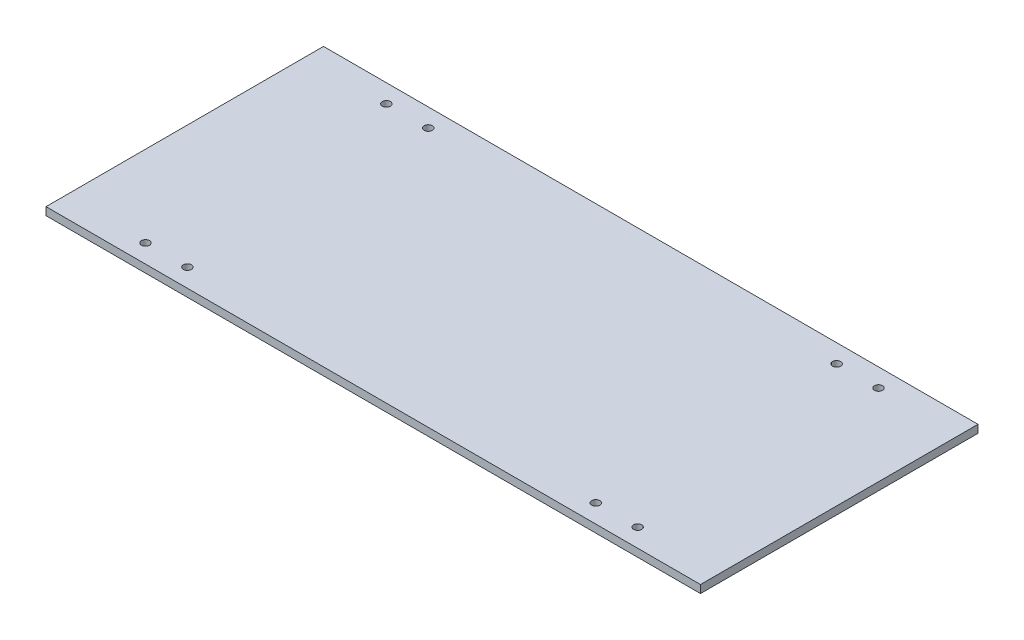
from build123d import *

# Parameters (mm, degrees)
SKETCH1_W           = 250
SKETCH1_H           = 106
SKETCH1_R           = 1.55
BOSS_EXTRUDE1_DEPTH = 3


with BuildPart() as part:
    # Sketch1 → Boss-Extrude1 (new body)
    with BuildSketch(Plane(origin=(0, 0, 0), x_dir=(1, 0, 0), z_dir=(0, 1, 0))):
        with Locations((125, 53)):
            Rectangle(SKETCH1_W, SKETCH1_H)
        with Locations((31, 99)):
            Circle(SKETCH1_R, mode=Mode.SUBTRACT)
        with Locations((47, 99)):
            Circle(SKETCH1_R, mode=Mode.SUBTRACT)
        with Locations((203, 99)):
            Circle(SKETCH1_R, mode=Mode.SUBTRACT)
        with Locations((219, 99)):
            Circle(SKETCH1_R, mode=Mode.SUBTRACT)
        with Locations((219, 7)):
            Circle(SKETCH1_R, mode=Mode.SUBTRACT)
        with Locations((203, 7)):
            Circle(SKETCH1_R, mode=Mode.SUBTRACT)
        with Locations((47, 7)):
            Circle(SKETCH1_R, mode=Mode.SUBTRACT)
        with Locations((31, 7)):
            Circle(SKETCH1_R, mode=Mode.SUBTRACT)
    extrude(amount=BOSS_EXTRUDE1_DEPTH)


solid = part.part
